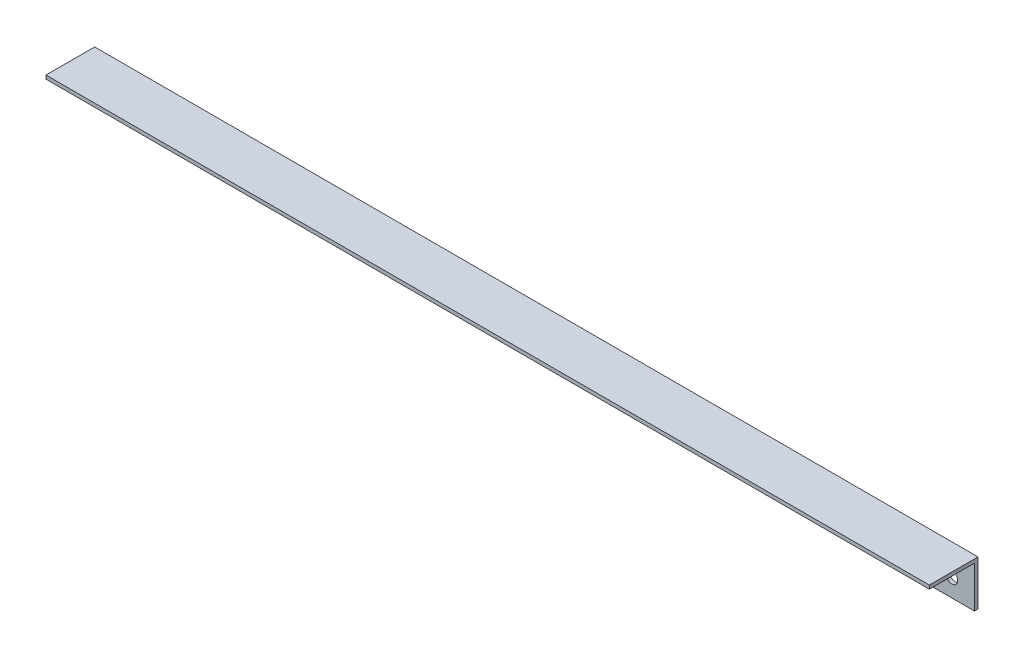
from build123d import *

# Parameters (mm, degrees)
SKETCH_1_W        = 1960
SKETCH_1_H        = 100
SKETCH_1_R        = 13
EXTRUDE_713_DEPTH = 8
SKETCH_2_W        = 1960
SKETCH_2_H        = 8
EXTRUDE_1_DEPTH   = 100


with BuildPart() as part:
    # 草图1 → Extrude 713 (new body)
    with BuildSketch(Plane.XY):
        with Locations((0, 44.512115183)):
            Rectangle(SKETCH_1_W, SKETCH_1_H)
        with Locations((930, 34.512115183)):
            Circle(SKETCH_1_R, mode=Mode.SUBTRACT)
        with Locations((850, 34.512115183)):
            Circle(SKETCH_1_R, mode=Mode.SUBTRACT)
        with Locations((770, 34.512115183)):
            Circle(SKETCH_1_R, mode=Mode.SUBTRACT)
        with Locations((330, 34.512115183)):
            Circle(SKETCH_1_R, mode=Mode.SUBTRACT)
        with Locations((250, 34.512115183)):
            Circle(SKETCH_1_R, mode=Mode.SUBTRACT)
        with Locations((-770, 34.512115183)):
            Circle(SKETCH_1_R, mode=Mode.SUBTRACT)
        with Locations((-850, 34.512115183)):
            Circle(SKETCH_1_R, mode=Mode.SUBTRACT)
        with Locations((170, 34.512115183)):
            Circle(SKETCH_1_R, mode=Mode.SUBTRACT)
        with Locations((-170, 34.512115183)):
            Circle(SKETCH_1_R, mode=Mode.SUBTRACT)
        with Locations((-250, 34.512115183)):
            Circle(SKETCH_1_R, mode=Mode.SUBTRACT)
        with Locations((-330, 34.512115183)):
            Circle(SKETCH_1_R, mode=Mode.SUBTRACT)
        with Locations((-930, 34.512115183)):
            Circle(SKETCH_1_R, mode=Mode.SUBTRACT)
    extrude(amount=EXTRUDE_713_DEPTH)

    # 草图2 → 凸台-拉伸1 (add)
    with BuildSketch(Plane.XY.offset(8)):
        with Locations((0, 90.512115183)):
            Rectangle(SKETCH_2_W, SKETCH_2_H)
    extrude(amount=EXTRUDE_1_DEPTH)


solid = part.part
